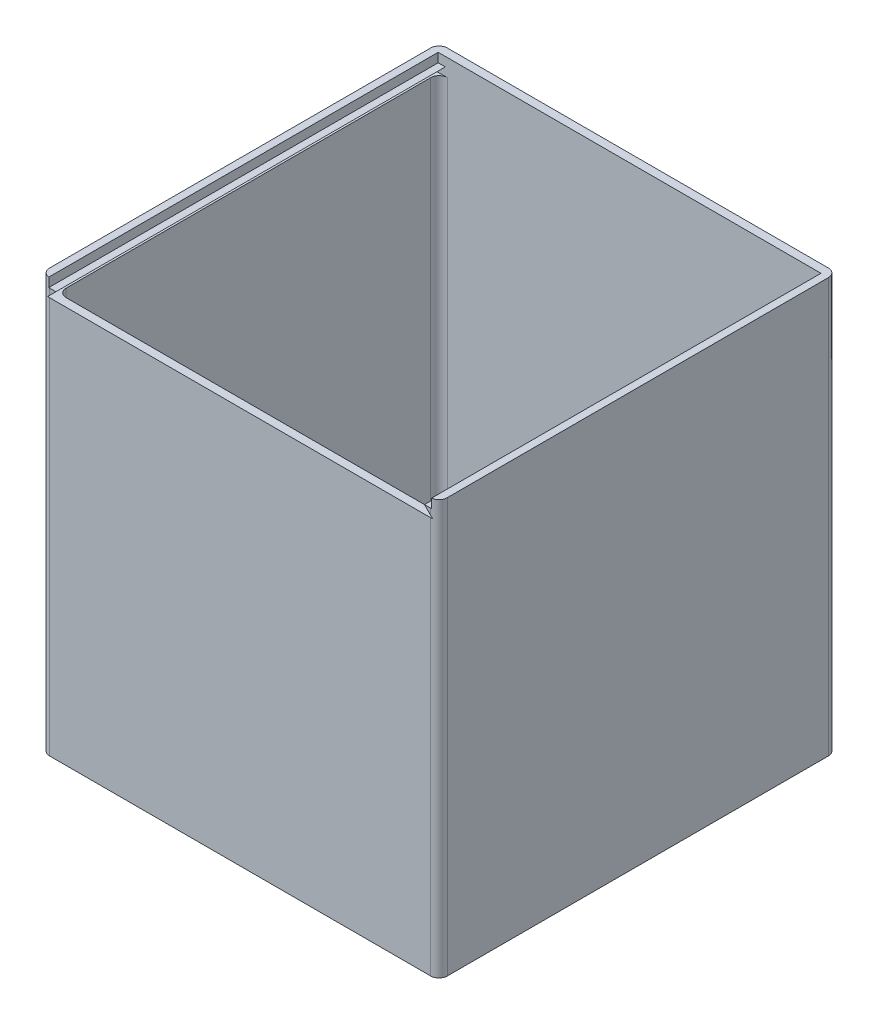
from build123d import *

# Parameters (mm, degrees)
EXTRUDE_1_DEPTH     = 50
CUT_EXTRUDE_1_DEPTH = 47
CUT_EXTRUDE_3_DEPTH = 6
SHELL_START         = 1
SHELL_1_OUTLINE_W   = 46
SHELL_1_OUTLINE_H   = 46
SHELL_1_DEPTH       = 46.9
SHELL_START_2       = 7
SHELL_1_2_DEPTH     = 40.9
CUT_EXTRUDE_4_REACH = 57.57
FILLET_2_R          = 1
EXTRUDE_START       = 1
SKETCH_10_R         = 0.7500000000000009
EXTRUDE_3_DEPTH     = 1


# Read off the part's stored shape, not the designer's step: 抽壳1
with BuildPart() as part:
    # 草图1 → 凸台-拉伸1 (new body)
    with BuildSketch(Plane(origin=(0, 0, 0), x_dir=(1, 0, 0), z_dir=(0, 1, 0))):
        Polygon((-24.000000000000007, 24.000000000000004), (23.999999999999993, 24.000000000000004), (24.000000000000004, -24), (-23.999999999999996, -24), align=None)
    extrude(amount=EXTRUDE_1_DEPTH)

    # 草图2 → 切除-拉伸1 (cut)
    with BuildSketch(Plane.XY.offset(24)):
        Polygon((23.1, 50), (23.000000000000004, 50), (23.000000000000004, 49.00000000000004), (22.000000000000007, 49.00000000000005), (23.000000000000004, 48.000000000000036), (22.000000000000117, 47.99999999999991), (21.000000000000004, 49.00000000000004), (-20.99999999999999, 49.00000000000003), (-21.99999999999998, 48.00000000000006), (-22.999999999999975, 48.00000000000005), (-21.999999999999996, 49.000000000000036), (-22.999999999999996, 49.000000000000036), (-22.999999999999996, 50), (-23.09999999999999, 50), (-23.099999999999994, 48.900000000000034), (-22.241421356237293, 48.900000000000034), (-23.24142135623728, 47.900000000000055), (-21.958578643762664, 47.90000000000006), (-20.95857864376269, 48.900000000000034), (20.9585786437627, 48.90000000000004), (21.95857864376282, 47.8999999999999), (23.241421356237286, 47.90000000000006), (22.24142135623732, 48.90000000000004), (23.1, 48.90000000000004), align=None)
        Polygon((23.000000000000004, 49.00000000000004), (23.000000000000004, 50), (-22.999999999999996, 50), (-22.999999999999996, 49.000000000000036), (-21.999999999999996, 49.000000000000036), (-22.999999999999975, 48.00000000000005), (-21.99999999999998, 48.00000000000006), (-20.99999999999999, 49.00000000000003), (21.000000000000004, 49.00000000000004), (22.000000000000117, 47.99999999999991), (23.000000000000004, 48.000000000000036), (22.000000000000007, 49.00000000000005), align=None)
        Polygon((-20.95857864376269, 48.900000000000034), (-21.958578643762664, 47.90000000000006), (21.95857864376282, 47.8999999999999), (20.9585786437627, 48.90000000000004), align=None)
    extrude(amount=-CUT_EXTRUDE_1_DEPTH, mode=Mode.SUBTRACT)

    # 草图6 → 切除-拉伸3 (cut)
    with BuildSketch(Plane.XZ):
        with BuildLine():
            Line((4.225283156367072, 0.45769230769231345), (2.485460680215815, 16.519230769230756))
            ThreePointArc((2.485460680215815, 16.519230769230756), (-1.2012e-13, 18.75), (-2.485460680216046, 16.51923076923075))
            Line((-2.485460680216046, 16.51923076923075), (-4.225283156367078, 0.4576923076922684))
            ThreePointArc((-4.225283156367078, 0.4576923076922684), (2.187e-14, -4.250000000000001), (4.225283156367072, 0.45769230769231345))
        make_face()
    extrude(amount=-CUT_EXTRUDE_3_DEPTH, mode=Mode.SUBTRACT)

    # 抽壳1 outline → 抽壳1 (cut)
    with BuildSketch(Plane(origin=(0, 0, 0), x_dir=(1, 0, 0), z_dir=(0, 1, 0)).offset(SHELL_START)):
        Rectangle(SHELL_1_OUTLINE_W, SHELL_1_OUTLINE_H)
        with BuildLine():
            Line((-3.479644952, -16.626923077), (-5.219467428, -0.565384615))
            ThreePointArc((-5.219467428, -0.565384615), (0, 5.25), (5.219467428, -0.565384615))
            Line((5.219467428, -0.565384615), (3.479644952, -16.626923077))
            ThreePointArc((3.479644952, -16.626923077), (0, -19.75), (-3.479644952, -16.626923077))
        make_face(mode=Mode.SUBTRACT)
    extrude(amount=SHELL_1_DEPTH, mode=Mode.SUBTRACT)

    # Shell 1 2 outline → Shell 1 2 (cut)
    with BuildSketch(Plane(origin=(0, 0, 0), x_dir=(1, 0, 0), z_dir=(0, 1, 0)).offset(SHELL_START_2)):
        with BuildLine():
            ThreePointArc((5.219467428, -0.565384615), (0, 5.25), (-5.219467428, -0.565384615))
            Line((-5.219467428, -0.565384615), (-3.479644952, -16.626923077))
            ThreePointArc((-3.479644952, -16.626923077), (0, -19.75), (3.479644952, -16.626923077))
            Line((3.479644952, -16.626923077), (5.219467428, -0.565384615))
        make_face()
    extrude(amount=SHELL_1_2_DEPTH, mode=Mode.SUBTRACT)

    # 草图7 → 切除-拉伸4 (cut, up to next)
    with BuildSketch(Plane.XZ.offset(-6), mode=Mode.PRIVATE) as cut_extrude_4_sk1:
        with BuildLine():
            ThreePointArc((1.0553e-13, -4.25), (3.1628857320248525, -2.8387768221812744), (4.225283156367072, 0.45769230769231267))
            Line((4.225283156367072, 0.45769230769231345), (3.6520083174819797, 5.75000000000003))
            Line((3.6520083174819793, 5.750000000000031), (-3.997e-14, 5.750000000000005))
            Line((-4.015e-14, 5.750000000000007), (2.968e-14, -4.25))
        make_face()
    cut_extrude_4_tool1 = extrude(cut_extrude_4_sk1.sketch, amount=-CUT_EXTRUDE_4_REACH, mode=Mode.PRIVATE) & part.part
    # 草图7 → 切除-拉伸4 (cut, up to next)
    with BuildSketch(Plane.XZ.offset(-6), mode=Mode.PRIVATE) as cut_extrude_4_sk2:
        with BuildLine():
            ThreePointArc((-4.225283156367077, 0.4576923076922684), (-3.162885732024767, -2.8387768221813694), (1.0553e-13, -4.25))
            Line((2.968e-14, -4.25), (-4.015e-14, 5.750000000000007))
            Line((-3.997e-14, 5.750000000000005), (-3.6520083174820606, 5.74999999999998))
            Line((-3.6520083174820623, 5.7499999999999805), (-4.225283156367078, 0.45769230769226965))
        make_face()
    cut_extrude_4_tool2 = extrude(cut_extrude_4_sk2.sketch, amount=-CUT_EXTRUDE_4_REACH, mode=Mode.PRIVATE) & part.part
    # 草图7 → 切除-拉伸4 (cut, up to next)
    with BuildSketch(Plane.XZ.offset(-6), mode=Mode.PRIVATE) as cut_extrude_4_sk3:
        with BuildLine():
            ThreePointArc((-7.866e-14, 9.439999999999992), (-0.7500000000000644, 8.689999999999989), (-7.185e-14, 7.9399999999999915))
            Line((-5.544e-14, 7.939999999999991), (-6.592e-14, 9.43999999999999))
        make_face()
    cut_extrude_4_tool3 = extrude(cut_extrude_4_sk3.sketch, amount=-CUT_EXTRUDE_4_REACH, mode=Mode.PRIVATE) & part.part
    # 草图7 → 切除-拉伸4 (cut, up to next)
    with BuildSketch(Plane.XZ.offset(-6), mode=Mode.PRIVATE) as cut_extrude_4_sk4:
        with BuildLine():
            Line((-6.592e-14, 9.43999999999999), (-5.544e-14, 7.939999999999991))
            ThreePointArc((-7.185e-14, 7.9399999999999915), (0.5303300858898444, 8.15966991411008), (0.7499999999999369, 8.689999999999992))
            ThreePointArc((0.7499999999999369, 8.689999999999992), (0.5303300858898421, 9.220330085889909), (-7.866e-14, 9.439999999999992))
        make_face()
    cut_extrude_4_tool4 = extrude(cut_extrude_4_sk4.sketch, amount=-CUT_EXTRUDE_4_REACH, mode=Mode.PRIVATE) & part.part
    # 草图7 → 切除-拉伸4 (cut, up to next)
    with BuildSketch(Plane.XZ.offset(-6), mode=Mode.PRIVATE) as cut_extrude_4_sk5:
        with BuildLine():
            ThreePointArc((-7.866e-14, 9.439999999999992), (-0.7500000000000644, 8.689999999999989), (-7.185e-14, 7.9399999999999915))
            Line((-5.544e-14, 7.939999999999991), (-6.592e-14, 9.43999999999999))
        make_face()
    cut_extrude_4_tool5 = extrude(cut_extrude_4_sk5.sketch, amount=-CUT_EXTRUDE_4_REACH, mode=Mode.PRIVATE) & part.part
    # 草图7 → 切除-拉伸4 (cut, up to next)
    with BuildSketch(Plane.XZ.offset(-6), mode=Mode.PRIVATE) as cut_extrude_4_sk6:
        with BuildLine():
            Line((-6.592e-14, 9.43999999999999), (-5.544e-14, 7.939999999999991))
            ThreePointArc((-7.185e-14, 7.9399999999999915), (0.5303300858898444, 8.15966991411008), (0.7499999999999369, 8.689999999999992))
            ThreePointArc((0.7499999999999369, 8.689999999999992), (0.5303300858898421, 9.220330085889909), (-7.866e-14, 9.439999999999992))
        make_face()
    cut_extrude_4_tool6 = extrude(cut_extrude_4_sk6.sketch, amount=-CUT_EXTRUDE_4_REACH, mode=Mode.PRIVATE) & part.part
    # 草图7 → 切除-拉伸4 (cut, up to next)
    with BuildSketch(Plane.XZ.offset(-6), mode=Mode.PRIVATE) as cut_extrude_4_sk7:
        with BuildLine():
            ThreePointArc((0.7499999999998826, 16.24), (0.5303300858897884, 16.770330085889913), (-1.3142e-13, 16.99))
            Line((-1.1864e-13, 16.989999999999995), (-1.0817e-13, 15.489999999999998))
            ThreePointArc((-1.2411e-13, 15.489999999999998), (0.5303300858897908, 15.709669914110085), (0.7499999999998826, 16.24))
        make_face()
    cut_extrude_4_tool7 = extrude(cut_extrude_4_sk7.sketch, amount=-CUT_EXTRUDE_4_REACH, mode=Mode.PRIVATE) & part.part
    # 草图7 → 切除-拉伸4 (cut, up to next)
    with BuildSketch(Plane.XZ.offset(-6), mode=Mode.PRIVATE) as cut_extrude_4_sk8:
        with BuildLine():
            Line((-1.0817e-13, 15.489999999999998), (-1.1864e-13, 16.989999999999995))
            ThreePointArc((-1.3142e-13, 16.99), (-0.7500000000001174, 16.239999999999995), (-1.2344e-13, 15.489999999999998))
        make_face()
    cut_extrude_4_tool8 = extrude(cut_extrude_4_sk8.sketch, amount=-CUT_EXTRUDE_4_REACH, mode=Mode.PRIVATE) & part.part
    # 草图7 → 切除-拉伸4 (cut, up to next)
    with BuildSketch(Plane.XZ.offset(-6), mode=Mode.PRIVATE) as cut_extrude_4_sk9:
        with BuildLine():
            ThreePointArc((0.7499999999998826, 16.24), (0.5303300858897884, 16.770330085889913), (-1.3142e-13, 16.99))
            Line((-1.1864e-13, 16.989999999999995), (-1.0817e-13, 15.489999999999998))
            ThreePointArc((-1.2411e-13, 15.489999999999998), (0.5303300858897908, 15.709669914110085), (0.7499999999998826, 16.24))
        make_face()
    cut_extrude_4_tool9 = extrude(cut_extrude_4_sk9.sketch, amount=-CUT_EXTRUDE_4_REACH, mode=Mode.PRIVATE) & part.part
    # 草图7 → 切除-拉伸4 (cut, up to next)
    with BuildSketch(Plane.XZ.offset(-6), mode=Mode.PRIVATE) as cut_extrude_4_sk10:
        with BuildLine():
            Line((-1.0817e-13, 15.489999999999998), (-1.1864e-13, 16.989999999999995))
            ThreePointArc((-1.3142e-13, 16.99), (-0.7500000000001174, 16.239999999999995), (-1.2344e-13, 15.489999999999998))
        make_face()
    cut_extrude_4_tool10 = extrude(cut_extrude_4_sk10.sketch, amount=-CUT_EXTRUDE_4_REACH, mode=Mode.PRIVATE) & part.part
    add(cut_extrude_4_tool1.solids().sort_by_distance((1.915714, 6, 1.033627))[0], mode=Mode.SUBTRACT)
    add(cut_extrude_4_tool2.solids().sort_by_distance((-1.915714, 6, 1.033627))[0], mode=Mode.SUBTRACT)
    add(cut_extrude_4_tool3.solids().sort_by_distance((-0.31831, 6, 8.69))[0], mode=Mode.SUBTRACT)
    add(cut_extrude_4_tool4.solids().sort_by_distance((0.31831, 6, 8.69))[0], mode=Mode.SUBTRACT)
    add(cut_extrude_4_tool5.solids().sort_by_distance((-0.31831, 6, 8.69))[0], mode=Mode.SUBTRACT)
    add(cut_extrude_4_tool6.solids().sort_by_distance((0.31831, 6, 8.69))[0], mode=Mode.SUBTRACT)
    add(cut_extrude_4_tool7.solids().sort_by_distance((0.31831, 6, 16.24))[0], mode=Mode.SUBTRACT)
    add(cut_extrude_4_tool8.solids().sort_by_distance((-0.31831, 6, 16.24))[0], mode=Mode.SUBTRACT)
    add(cut_extrude_4_tool9.solids().sort_by_distance((0.31831, 6, 16.24))[0], mode=Mode.SUBTRACT)
    add(cut_extrude_4_tool10.solids().sort_by_distance((-0.31831, 6, 16.24))[0], mode=Mode.SUBTRACT)

    # 圆角2
    # the kernel refuses this fillet: 1 mm, written as the material it adds along each edge
    with BuildSketch(Plane(origin=(22, 2, -22), x_dir=(0, -1, 0), z_dir=(1, 0, 0))) as fillet_2_piece_1_section:
        Polygon((0, 0), (FILLET_2_R, 0), (FILLET_2_R, FILLET_2_R), (0, FILLET_2_R), align=None)
    fillet_2_piece_1 = extrude(amount=FILLET_2_R, mode=Mode.PRIVATE)
    fillet_2_piece_1 = fillet_2_piece_1 - Plane(origin=(22, 2, -22), x_dir=(0, 0.7071067811865475, 0.7071067811865475), z_dir=(1, 0, 0)) * Sphere(FILLET_2_R, mode=Mode.PRIVATE)
    add(fillet_2_piece_1)
    with BuildSketch(Plane(origin=(-22, 2, -22), x_dir=(0, -1, 0), z_dir=(-1, 0, 0))) as fillet_2_piece_2_section:
        Polygon((0, 0), (FILLET_2_R, 0), (FILLET_2_R, -FILLET_2_R), (0, -FILLET_2_R), align=None)
    fillet_2_piece_2 = extrude(amount=FILLET_2_R, mode=Mode.PRIVATE)
    fillet_2_piece_2 = fillet_2_piece_2 - Plane(origin=(-22, 2, -22), x_dir=(0, 0.7071067811865475, 0.7071067811865475), z_dir=(-1, 0, 0)) * Sphere(FILLET_2_R, mode=Mode.PRIVATE)
    add(fillet_2_piece_2)
    with BuildSketch(Plane(origin=(22, 2, 22), x_dir=(0, -1, 0), z_dir=(1, 0, 0))) as fillet_2_piece_3_section:
        Polygon((0, 0), (FILLET_2_R, 0), (FILLET_2_R, -FILLET_2_R), (0, -FILLET_2_R), align=None)
    fillet_2_piece_3 = extrude(amount=FILLET_2_R, mode=Mode.PRIVATE)
    fillet_2_piece_3 = fillet_2_piece_3 - Plane(origin=(22, 2, 22), x_dir=(0, 0.7071067811865475, -0.7071067811865475), z_dir=(1, 0, 0)) * Sphere(FILLET_2_R, mode=Mode.PRIVATE)
    add(fillet_2_piece_3)
    with BuildSketch(Plane(origin=(-22, 2, 22), x_dir=(0, -1, 0), z_dir=(-1, 0, 0))) as fillet_2_piece_4_section:
        Polygon((0, 0), (FILLET_2_R, 0), (FILLET_2_R, FILLET_2_R), (0, FILLET_2_R), align=None)
    fillet_2_piece_4 = extrude(amount=FILLET_2_R, mode=Mode.PRIVATE)
    fillet_2_piece_4 = fillet_2_piece_4 - Plane(origin=(-22, 2, 22), x_dir=(0, 0.7071067811865475, -0.7071067811865475), z_dir=(-1, 0, 0)) * Sphere(FILLET_2_R, mode=Mode.PRIVATE)
    add(fillet_2_piece_4)
    with BuildSketch(Plane(origin=(-1.1e-16, 1, 16.250000000327525), x_dir=(0.9941842720930342, 0, 0.1076923076307851), z_dir=(0.1076923076307851, 0, -0.9941842720930342))) as fillet_2_piece_5:
        with BuildLine():
            CenterArc((3.4999999996724753 + FILLET_2_R, -FILLET_2_R), FILLET_2_R, 90, 90)
            Line((3.4999999996724753, -FILLET_2_R), (3.4999999996724753, 0))
            Line((3.4999999996724753, 0), (3.4999999996724753 + FILLET_2_R, 0))
        make_face()
    revolve(axis=Axis((-1.1e-16, 1, 16.250000000327525), (0, -1, 0)), revolution_arc=167.63539153430426)
    with BuildSketch(Plane(origin=(5.219467428, 1, 0.565384615), x_dir=(0.994184272087703, 0, 0.10769230768000165), z_dir=(-0.10769230768000165, 0, 0.994184272087703))) as fillet_2_piece_6:
        with BuildLine():
            CenterArc((FILLET_2_R, FILLET_2_R), FILLET_2_R, 180, 90)
            Line((0, FILLET_2_R), (0, 0))
            Line((0, 0), (FILLET_2_R, 0))
        make_face()
    extrude(amount=16.15549442184609)
    with BuildSketch(Plane(origin=(0, 1.0, -4.4436987423068786e-10), x_dir=(-0.9941842720841496, 0, 0.10769230771280479), z_dir=(0.10769230771280479, 0, 0.9941842720841496))) as fillet_2_piece_7:
        with BuildLine():
            CenterArc((5.24999999955563 + FILLET_2_R, -FILLET_2_R), FILLET_2_R, 90, 90)
            Line((5.24999999955563, -FILLET_2_R), (5.24999999955563, 0))
            Line((5.24999999955563, 0), (5.24999999955563 + FILLET_2_R, 0))
        make_face()
    revolve(axis=Axis((0, 1.0, -4.4436987423068786e-10), (0, -1, 0)), revolution_arc=192.36460847514948)
    with BuildSketch(Plane(origin=(-3.479644952, 1, 16.626923077), x_dir=(-0.9941842720877031, 0, 0.10769230768000167), z_dir=(-0.10769230768000165, 0, -0.994184272087703))) as fillet_2_piece_8:
        with BuildLine():
            CenterArc((FILLET_2_R, FILLET_2_R), FILLET_2_R, 180, 90)
            Line((0, FILLET_2_R), (0, 0))
            Line((0, 0), (FILLET_2_R, 0))
        make_face()
    extrude(amount=16.15549442184609)
    with BuildSketch(Plane(origin=(22, 1, -23), x_dir=(0, 0, 1), z_dir=(-1, 0, 0)), Plane(origin=(23, 1, 22), x_dir=(-1, 0, 0), z_dir=(0, 0, -1)), Plane(origin=(-22, 1, 23), x_dir=(0, 0, -1), z_dir=(1, 0, 0))) as fillet_2_piece_9:
        with BuildLine():
            CenterArc((FILLET_2_R, FILLET_2_R), FILLET_2_R, 180, 90)
            Line((0, FILLET_2_R), (0, 0))
            Line((0, 0), (FILLET_2_R, 0))
        make_face()
    extrude(amount=44)
    with BuildSketch(Plane(origin=(-23, 1.9999999999999998, -23), x_dir=(0, 0, 1), z_dir=(0, 1, 0))) as fillet_2_piece_10:
        with BuildLine():
            CenterArc((FILLET_2_R, FILLET_2_R), FILLET_2_R, 180, 90)
            Line((0, FILLET_2_R), (0, 0))
            Line((0, 0), (FILLET_2_R, 0))
        make_face()
    extrude(amount=45.9)
    with BuildSketch(Plane(origin=(23, 1.9999999999999998, -23), x_dir=(0, 0, 1), z_dir=(0, 1, 0)), Plane(origin=(23, 1.9999999999999998, 23), x_dir=(-1, 0, 0), z_dir=(0, 1, 0)), Plane(origin=(-23, 1.9999999999999998, 23), x_dir=(0, 0, -1), z_dir=(0, 1, 0))) as fillet_2_piece_11:
        with BuildLine():
            CenterArc((FILLET_2_R, -FILLET_2_R), FILLET_2_R, 90, 90)
            Line((0, -FILLET_2_R), (0, 0))
            Line((0, 0), (FILLET_2_R, 0))
        make_face()
    extrude(amount=45.9)
    with BuildSketch(Plane(origin=(-23, 1, -22), x_dir=(0, 1, 0), z_dir=(0, 0, 1))) as fillet_2_piece_12:
        with BuildLine():
            CenterArc((FILLET_2_R, -FILLET_2_R), FILLET_2_R, 90, 90)
            Line((0, -FILLET_2_R), (0, 0))
            Line((0, 0), (FILLET_2_R, 0))
        make_face()
    extrude(amount=44)
    # the kernel refuses this fillet: 1 mm, written as the material it takes off along each edge
    with BuildSketch(Plane(origin=(23.999999999999993, -2.5, -24.000000000000004), x_dir=(-1, 0, 0), z_dir=(0, 1, 0)), Plane(origin=(-23.999999999999996, -2.5, 24), x_dir=(1, 0, 0), z_dir=(0, 1, 0))) as fillet_2_2_piece_1:
        with BuildLine():
            CenterArc((FILLET_2_R, FILLET_2_R), FILLET_2_R, 180, 90)
            Line((0, FILLET_2_R), (0, 0))
            Line((0, 0), (FILLET_2_R, 0))
        make_face()
    extrude(amount=55, mode=Mode.SUBTRACT)
    with BuildSketch(Plane(origin=(24.000000000000004, -2.5, 24), x_dir=(-1, 0, 0), z_dir=(0, 1, 0)), Plane(origin=(-24.000000000000007, -2.5, -24.000000000000004), x_dir=(1, 0, 0), z_dir=(0, 1, 0))) as fillet_2_2_piece_2:
        with BuildLine():
            CenterArc((FILLET_2_R, -FILLET_2_R), FILLET_2_R, 90, 89.9999999999998)
            Line((0, -FILLET_2_R), (0, 0))
            Line((0, 0), (FILLET_2_R, 0))
        make_face()
    extrude(amount=55, mode=Mode.SUBTRACT)

    # 草图10 → 凸台-拉伸3 (add)
    with BuildSketch(Plane.XZ.offset(-6).offset(EXTRUDE_START)):
        with BuildLine():
            Line((-3.6520083174820623, 5.74999999999998), (3.6520083174819797, 5.75000000000003))
            Line((3.6520083174819797, 5.75000000000003), (2.4854606802158132, 16.519230769230756))
            ThreePointArc((2.4854606802158132, 16.519230769230756), (-1.2012e-13, 18.749999999999996), (-2.485460680216047, 16.51923076923075))
            Line((-2.485460680216047, 16.51923076923075), (-3.6520083174820623, 5.74999999999998))
        make_face()
        with Locations(Location((-6.372e-14, 8.689999999999992, 0), (0, 0, 270))):
            Circle(SKETCH_10_R, mode=Mode.SUBTRACT)
        with Locations(Location((-1.1731e-13, 16.24, 0), (0, 0, 270))):
            Circle(SKETCH_10_R, mode=Mode.SUBTRACT)
    extrude(amount=-EXTRUDE_3_DEPTH)


solid = part.part
